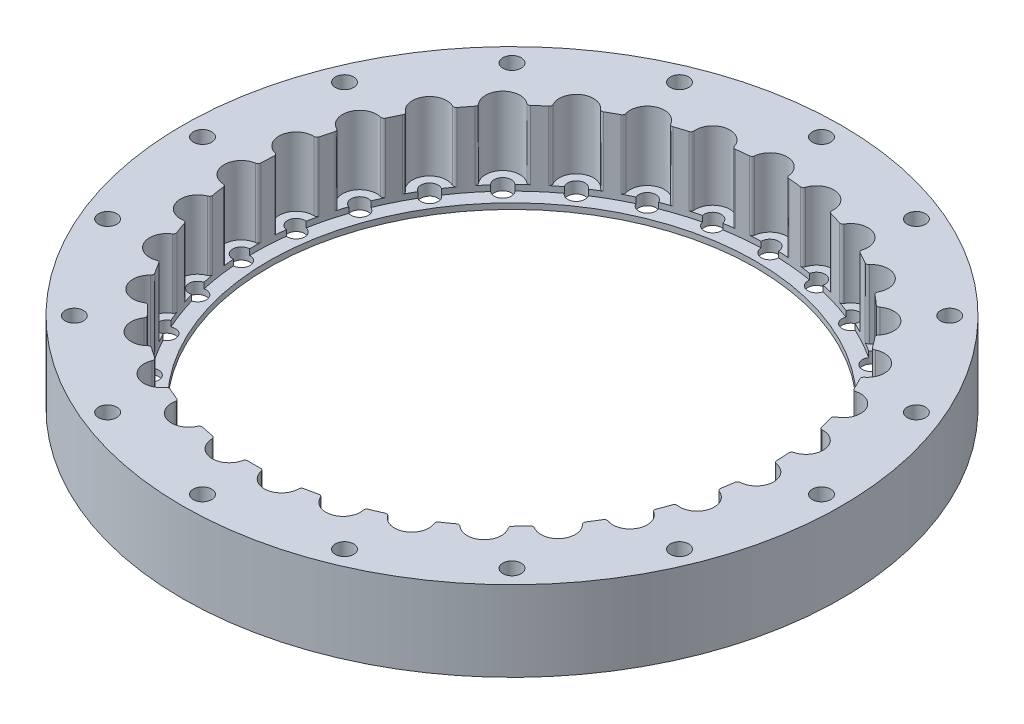
from build123d import *

# Parameters (mm, degrees)
SKETCH1_R                = 57.5
SKETCH1_R_2              = 45
BOSS_EXTRUDE1_DEPTH      = 12
BOSS_EXTRUDE2_START      = 1
SKETCH2_R                = 57.5
SKETCH2_R_2              = 45
BOSS_EXTRUDE2_DEPTH      = 1
BOSS_EXTRUDE3_START      = 1
SKETCH3_R                = 57.5
SKETCH3_R_2              = 42.5
BOSS_EXTRUDE3_DEPTH      = 1
SKETCH5_R                = 3
CUT_EXTRUDE2_DEPTH       = 12
FILLET4_R                = 0.5
SKETCH7_R                = 1.5
CUT_EXTRUDE3_DEPTH       = 10
CIRPATTERN3_COUNT        = 31
FILLET4_OF_CIRPATTERN3_R = 0.5
SKETCH4_R                = 1.6
CUT_EXTRUDE1_DEPTH       = 51


with BuildPart() as part:
    # Sketch1 → Boss-Extrude1 (new body)
    with BuildSketch(Plane(origin=(0, 0, 0), x_dir=(1, 0, 0), z_dir=(0, 1, 0))):
        Circle(SKETCH1_R)
        Circle(SKETCH1_R_2, mode=Mode.SUBTRACT)
    extrude(amount=BOSS_EXTRUDE1_DEPTH)

    # Sketch2 → Boss-Extrude2 (add)
    with BuildSketch(Plane.XZ.offset(BOSS_EXTRUDE2_START)):
        Circle(SKETCH2_R)
        Circle(SKETCH2_R_2, mode=Mode.SUBTRACT)
    extrude(amount=-BOSS_EXTRUDE2_DEPTH)

    # Sketch3 → Boss-Extrude3 (add)
    with BuildSketch(Plane.XZ.offset(1).offset(BOSS_EXTRUDE3_START)):
        Circle(SKETCH3_R)
        Circle(SKETCH3_R_2, mode=Mode.SUBTRACT)
    extrude(amount=-BOSS_EXTRUDE3_DEPTH)

    # Sketch5 → Cut-Extrude2 (cut)
    with BuildSketch(Plane(origin=(0, 12, 0), x_dir=(1, 0, 0), z_dir=(0, 1, 0))):
        with Locations((0, 45)):
            Circle(SKETCH5_R)
    cut_extrude2 = extrude(amount=-CUT_EXTRUDE2_DEPTH, mode=Mode.SUBTRACT)

    # Fillet4
    fillet4_edges = [part.edges().sort_by_distance(p)[0] for p in [
        (2.99833287, 6, -44.9),
        (-2.99833287, 6, -44.9),
    ]]
    fillet(fillet4_edges, radius=FILLET4_R)

    # Sketch7 → Cut-Extrude3 (cut)
    with BuildSketch(Plane(origin=(0, 0, 0), x_dir=(1, 0, 0), z_dir=(0, 1, 0))):
        with Locations((0, 45)):
            Circle(SKETCH7_R)
    cut_extrude3 = extrude(amount=-CUT_EXTRUDE3_DEPTH, mode=Mode.SUBTRACT)

    # CirPattern3: Cut-Extrude2, Cut-Extrude3 ×31 about axis
    cirpattern3_axis = Axis((0, -2, 0), (0, 1, 0))
    add([cut_extrude2.rotate(cirpattern3_axis, i * 360 / CIRPATTERN3_COUNT) for i in range(1, CIRPATTERN3_COUNT)], mode=Mode.SUBTRACT)
    add([cut_extrude3.rotate(cirpattern3_axis, i * 360 / CIRPATTERN3_COUNT) for i in range(1, CIRPATTERN3_COUNT)], mode=Mode.SUBTRACT)

    # Fillet4 of CirPattern3
    fillet4_of_cirpattern3_edges = [part.edges().sort_by_distance(p)[0] for p in [
        (-6.101346732, 6, -44.584454332),
        (-11.975260372, 6, -43.377334393),
        (-14.951236482, 6, -42.443615865),
        (-20.461919307, 6, -40.078795619),
        (-23.189020853, 6, -38.565130777),
        (-28.110864862, 6, -35.139426243),
        (-30.477443987, 6, -33.107784704),
        (-34.608948306, 6, -28.761444629),
        (-36.518116982, 6, -26.295002036),
        (-39.690137341, 6, -21.205966091),
        (-41.063733978, 6, -18.405698895),
        (-43.146407489, 6, -12.782312811),
        (-43.92819688, 6, -9.762864278),
        (-44.836258645, 6, -3.835350142),
        (-44.99423424, 6, -0.720336851),
        (-44.690508104, 6, 5.268632212),
        (-44.218202364, 6, 8.351681252),
        (-42.715122911, 6, 14.156916145),
        (-41.631872087, 6, 17.081780543),
        (-38.990975566, 6, 22.465614267),
        (-37.341128076, 6, 25.112549731),
        (-33.670533101, 6, 29.854567501),
        (-31.521633894, 6, 32.115208183),
        (-26.971615054, 6, 36.021271235),
        (-24.411640317, 6, 37.803066239),
        (-19.168475919, 6, 40.713259891),
        (-16.302231317, 6, 41.943262321),
        (-10.580577126, 6, 43.738442904),
        (-7.525407051, 6, 44.366296315),
        (-1.559508263, 6, 44.972968926),
        (1.559508263, 6, 44.972968926),
        (7.525407051, 6, 44.366296315),
        (10.580577126, 6, 43.738442904),
        (16.302231317, 6, 41.943262321),
        (19.168475919, 6, 40.713259891),
        (24.411640317, 6, 37.803066239),
        (26.971615054, 6, 36.021271235),
        (31.521633894, 6, 32.115208183),
        (33.670533101, 6, 29.854567501),
        (37.341128076, 6, 25.112549731),
        (38.990975566, 6, 22.465614267),
        (41.631872087, 6, 17.081780543),
        (42.715122911, 6, 14.156916145),
        (44.218202364, 6, 8.351681252),
        (44.690508104, 6, 5.268632212),
        (44.99423424, 6, -0.720336851),
        (44.836258645, 6, -3.835350142),
        (43.92819688, 6, -9.762864278),
        (43.146407489, 6, -12.782312811),
        (41.063733978, 6, -18.405698895),
        (39.690137341, 6, -21.205966091),
        (36.518116982, 6, -26.295002036),
        (34.608948306, 6, -28.761444629),
        (30.477443987, 6, -33.107784704),
        (28.110864862, 6, -35.139426243),
        (23.189020853, 6, -38.565130777),
        (20.461919307, 6, -40.078795619),
        (14.951236482, 6, -42.443615865),
        (11.975260372, 6, -43.377334393),
        (6.101346732, 6, -44.584454332),
    ]]
    fillet(fillet4_of_cirpattern3_edges, radius=FILLET4_OF_CIRPATTERN3_R)

    # Sketch4 → Cut-Extrude1 (cut)
    with BuildSketch(Plane(origin=(0, 12, 0), x_dir=(1, 0, 0), z_dir=(0, 1, 0))):
        with Locations((0, 54)):
            Circle(SKETCH4_R)
        with Locations((20.664905348, 49.889494756)):
            Circle(SKETCH4_R)
        with Locations((38.183766184, 38.183766184)):
            Circle(SKETCH4_R)
        with Locations((49.889494756, 20.664905348)):
            Circle(SKETCH4_R)
        with Locations((54, 0)):
            Circle(SKETCH4_R)
        with Locations((49.889494756, -20.664905348)):
            Circle(SKETCH4_R)
        with Locations((38.183766184, -38.183766184)):
            Circle(SKETCH4_R)
        with Locations((20.664905348, -49.889494756)):
            Circle(SKETCH4_R)
        with Locations((0, -54)):
            Circle(SKETCH4_R)
        with Locations((-20.664905348, -49.889494756)):
            Circle(SKETCH4_R)
        with Locations((-38.183766184, -38.183766184)):
            Circle(SKETCH4_R)
        with Locations((-49.889494756, -20.664905348)):
            Circle(SKETCH4_R)
        with Locations((-54, 0)):
            Circle(SKETCH4_R)
        with Locations((-49.889494756, 20.664905348)):
            Circle(SKETCH4_R)
        with Locations((-38.183766184, 38.183766184)):
            Circle(SKETCH4_R)
        with Locations((-20.664905348, 49.889494756)):
            Circle(SKETCH4_R)
    extrude(amount=-CUT_EXTRUDE1_DEPTH, mode=Mode.SUBTRACT)


solid = part.part
